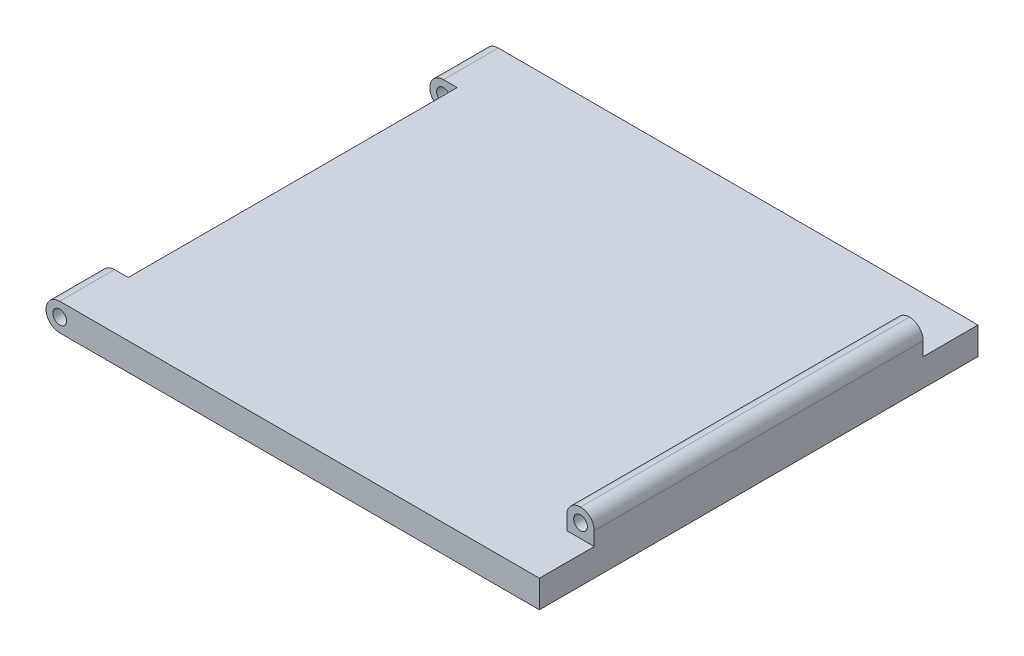
from build123d import *

# Parameters (mm, degrees)
BOSS_EXTRUDE1_DEPTH     = 40
BOSS_EXTRUDE2_START     = 30
SKETCH2_R               = 1.25
BOSS_EXTRUDE2_DEPTH     = 10
CUT_EXTRUDE1_START      = -30
SKETCH3_W               = 5
SKETCH3_H               = 5
CUT_EXTRUDE1_DEPTH      = 10
CUT_EXTRUDE2_DEPTH      = 95.472218138
CUT_EXTRUDE2_DEPTH_BACK = 95.472218138
SKETCH4_R               = 1.25
FILLET1_R               = 2.5


with BuildPart() as part:
    # Sketch1 → Boss-Extrude1 (new, symmetric)
    with BuildSketch(Plane.XY):
        Polygon((0, 0), (85, 0), (85, 10), (80, 10), (80, 5), (0, 5), align=None)
    extrude(amount=BOSS_EXTRUDE1_DEPTH, both=True)

    # Sketch2 → Boss-Extrude2 (add)
    with BuildSketch(Plane.XY.offset(BOSS_EXTRUDE2_START)):
        with BuildLine():
            Line((0, 5), (-2.5, 5))
            ThreePointArc((-2.5, 5), (-5, 2.5), (-2.5, 0))
            Line((-2.5, 0), (0, 0))
            Line((0, 0), (0, 5))
        make_face()
        with Locations((-2.5, 2.5)):
            Circle(SKETCH2_R, mode=Mode.SUBTRACT)
    boss_extrude2 = extrude(amount=BOSS_EXTRUDE2_DEPTH)

    # Mirror2: Boss-Extrude2 across plane
    add(boss_extrude2.mirror(Plane.XY))

    # Sketch3 → Cut-Extrude1 (cut)
    with BuildSketch(Plane.XY.offset(CUT_EXTRUDE1_START)):
        with Locations((82.5, 7.5)):
            Rectangle(SKETCH3_W, SKETCH3_H)
    cut_extrude1 = extrude(amount=-CUT_EXTRUDE1_DEPTH, mode=Mode.SUBTRACT)

    # Mirror3: Cut-Extrude1 across plane
    add(cut_extrude1.mirror(Plane.XY), mode=Mode.SUBTRACT)

    # Sketch4 → Cut-Extrude2 (cut, two sides: drawn at the far end of the back side and taken through both)
    with BuildSketch(Plane.XY.offset(-CUT_EXTRUDE2_DEPTH_BACK)):
        with Locations((82.5, 7.5)):
            Circle(SKETCH4_R)
    extrude(amount=CUT_EXTRUDE2_DEPTH + CUT_EXTRUDE2_DEPTH_BACK, mode=Mode.SUBTRACT)

    # Fillet1
    fillet1_edges = [part.edges().sort_by_distance(p)[0] for p in [
        (80, 10, 0),
        (85, 10, 0),
    ]]
    fillet(fillet1_edges, radius=FILLET1_R - 0.0001)  # a hair under: the kernel refuses the full size


solid = part.part
